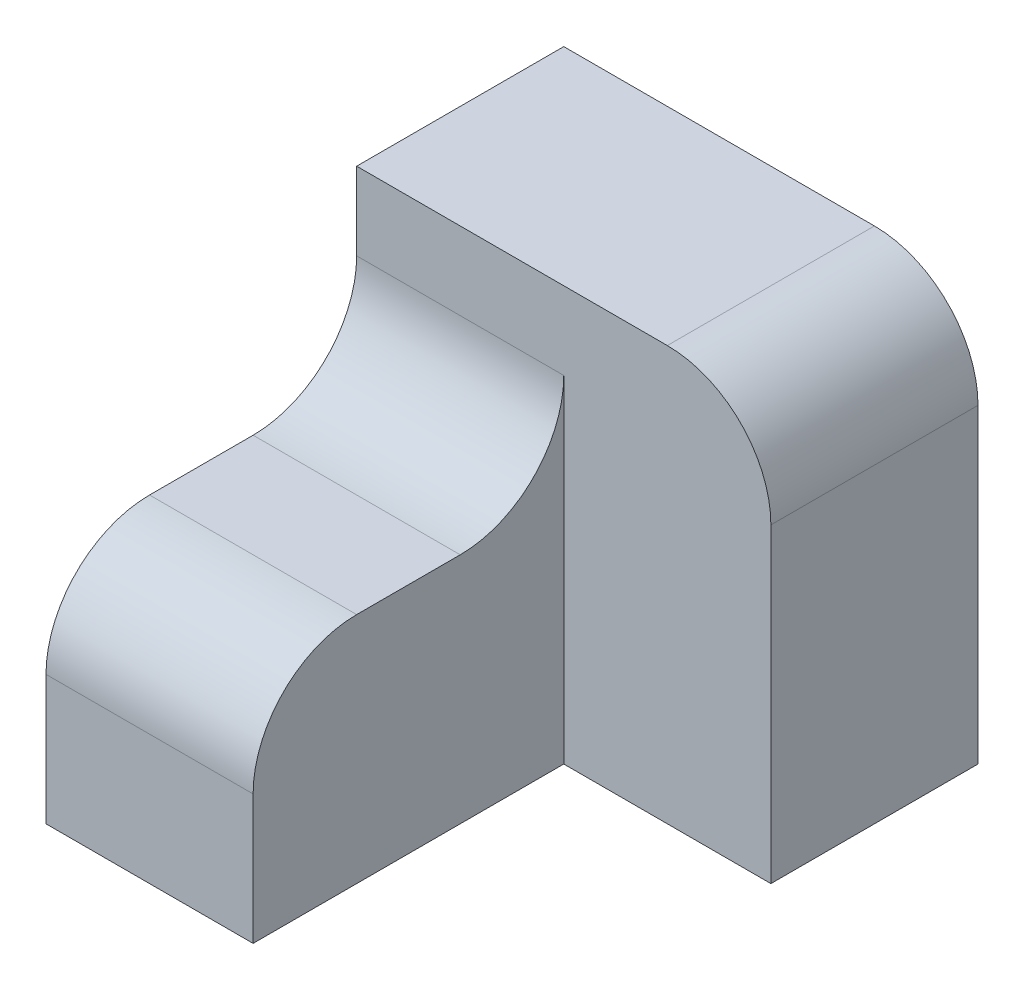
from build123d import *

# Parameters (mm, degrees)
SKETCH1_W           = 20
SKETCH1_H           = 22.5
BOSS_EXTRUDE1_DEPTH = 30
SKETCH2_W           = 40
SKETCH2_H           = 40
BOSS_EXTRUDE2_DEPTH = 20
FILLET1_R           = 10


with BuildPart() as part:
    # Sketch1 → Boss-Extrude1 (new body)
    with BuildSketch(Plane.XY):
        with Locations((-20, -11.25)):
            Rectangle(SKETCH1_W, SKETCH1_H)
    extrude(amount=BOSS_EXTRUDE1_DEPTH)

    # Sketch2 → Boss-Extrude2 (add)
    with BuildSketch(Plane.XY):
        with Locations((-10, -2.5)):
            Rectangle(SKETCH2_W, SKETCH2_H)
    extrude(amount=-BOSS_EXTRUDE2_DEPTH)

    # Fillet1
    fillet1_edges = [part.edges().sort_by_distance(p)[0] for p in [
        (-20, 0, 0),
        (10, 17.5, -10),
        (-20, 0, 30),
    ]]
    fillet(fillet1_edges, radius=FILLET1_R)


solid = part.part
